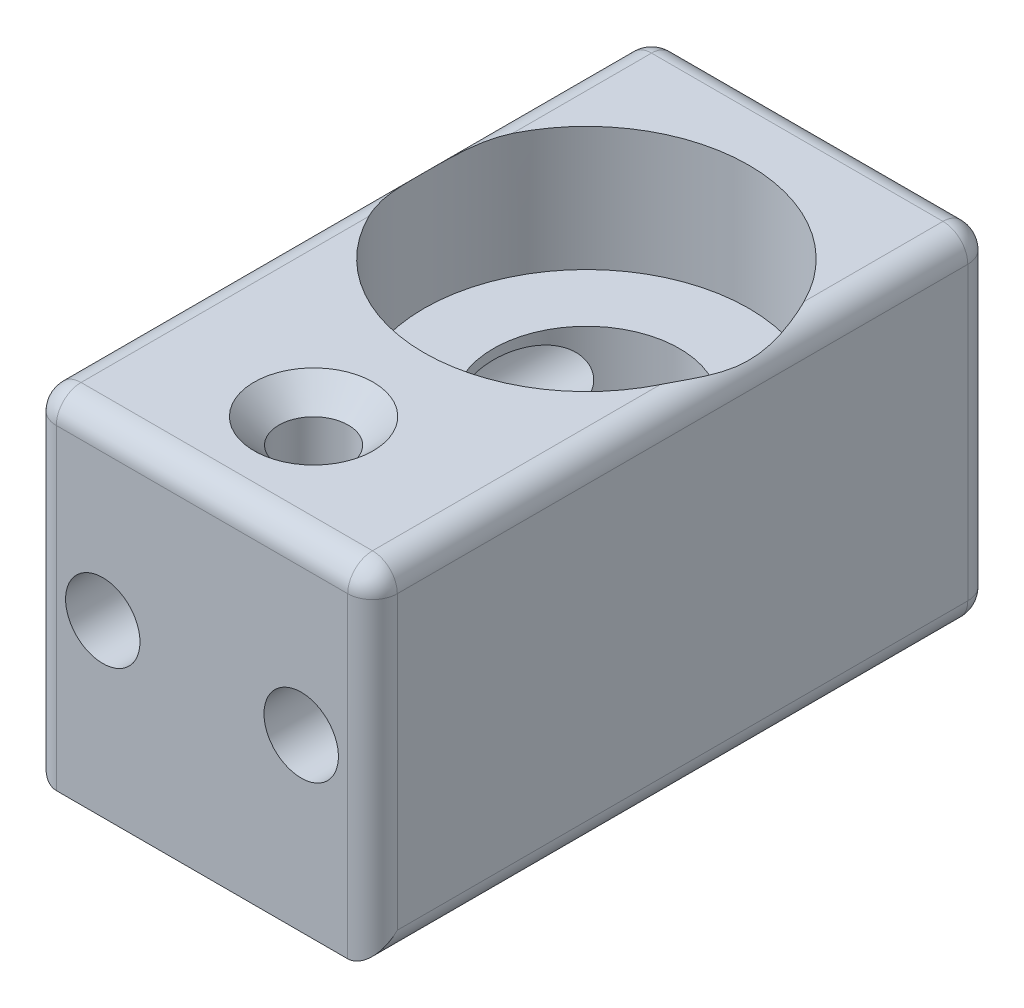
from build123d import *

# Parameters (mm, degrees)
SKETCH1_W           = 13.75
SKETCH1_H           = 13.75
BOSS_EXTRUDE1_DEPTH = 25
SKETCH3_R           = 3.75
CUT_EXTRUDE2_DEPTH  = 30.348392205
SKETCH4_R           = 6.55
CUT_EXTRUDE3_DEPTH  = 5
SKETCH8_R           = 1.4
CUT_EXTRUDE6_DEPTH  = 30.348392205
SKETCH9_R           = 1.5
CUT_EXTRUDE7_DEPTH  = 27.824079667
CHAMFER1_SIZE       = 1
FILLET2_R           = 1


with BuildPart() as part:
    # Sketch1 → Boss-Extrude1 (new body)
    with BuildSketch(Plane.XY):
        Rectangle(SKETCH1_W, SKETCH1_H)
    extrude(amount=BOSS_EXTRUDE1_DEPTH)

    # Sketch3 → Cut-Extrude2 (cut, through all)
    with BuildSketch(Plane(origin=(0, 6.875, 0), x_dir=(1, 0, 0), z_dir=(0, 1, 0))):
        with Locations(Location((0, -9.5, 0), (0, 0, 270))):
            Circle(SKETCH3_R)
    extrude(amount=-CUT_EXTRUDE2_DEPTH, mode=Mode.SUBTRACT)

    # Sketch4 → Cut-Extrude3 (cut)
    with BuildSketch(Plane(origin=(0, 6.875, 0), x_dir=(1, 0, 0), z_dir=(0, 1, 0))):
        with Locations(Location((0, -9.5, 0), (0, 0, 270))):
            Circle(SKETCH4_R)
    cut_extrude3 = extrude(amount=-CUT_EXTRUDE3_DEPTH, mode=Mode.SUBTRACT)

    # Mirror4: Cut-Extrude3 across plane
    add(cut_extrude3.mirror(Plane.ZX), mode=Mode.SUBTRACT)

    # Sketch8 → Cut-Extrude6 (cut, through all)
    with BuildSketch(Plane(origin=(0, 6.875, 0), x_dir=(1, 0, 0), z_dir=(0, 1, 0))):
        with Locations(Location((0, -20.5, 0), (0, 0, 270))):
            Circle(SKETCH8_R)
    extrude(amount=-CUT_EXTRUDE6_DEPTH, mode=Mode.SUBTRACT)

    # Sketch9 → Cut-Extrude7 (cut, through all)
    with BuildSketch(Plane(origin=(0, 0, 0), x_dir=(-1, 0, 0), z_dir=(0, 0, -1))):
        with Locations((-4, 0)):
            Circle(SKETCH9_R)
    cut_extrude7 = extrude(amount=-CUT_EXTRUDE7_DEPTH, mode=Mode.SUBTRACT)

    # Mirror5: Cut-Extrude7 across plane
    add(cut_extrude7.mirror(Plane(origin=(0, 0, 0), x_dir=(0, 0, 1), z_dir=(1, 0, 0))), mode=Mode.SUBTRACT)

    # Chamfer1
    chamfer1_edges = [part.edges().sort_by_distance(p)[0] for p in [
        (0, -6.875, 19.1),
        (0, 6.875, 19.1),
    ]]
    chamfer(chamfer1_edges, length=CHAMFER1_SIZE)

    # Fillet2
    # the kernel refuses this fillet: 1 mm, written as the material it takes off along each edge
    with BuildSketch(Plane(origin=(-5.875, 5.875, 24), x_dir=(-1, 0, 0), z_dir=(0, 1, 0))) as fillet2_piece_1_section:
        Polygon((0, 0), (FILLET2_R, 0), (FILLET2_R, FILLET2_R), (0, FILLET2_R), align=None)
    fillet2_piece_1 = extrude(amount=FILLET2_R, mode=Mode.PRIVATE)
    fillet2_piece_1 = fillet2_piece_1 - Plane(origin=(-5.875, 5.875, 24), x_dir=(0.7071067811865475, 0, -0.7071067811865475), z_dir=(0, 1, 0)) * Sphere(FILLET2_R, mode=Mode.PRIVATE)
    add(fillet2_piece_1, mode=Mode.SUBTRACT)
    with BuildSketch(Plane(origin=(5.875, 5.875, 24), x_dir=(0, 0, 1), z_dir=(0, 1, 0))) as fillet2_piece_2_section:
        Polygon((0, 0), (FILLET2_R, 0), (FILLET2_R, FILLET2_R), (0, FILLET2_R), align=None)
    fillet2_piece_2 = extrude(amount=FILLET2_R, mode=Mode.PRIVATE)
    fillet2_piece_2 = fillet2_piece_2 - Plane(origin=(5.875, 5.875, 24), x_dir=(-0.7071067811865475, 0, -0.7071067811865475), z_dir=(0, 1, 0)) * Sphere(FILLET2_R, mode=Mode.PRIVATE)
    add(fillet2_piece_2, mode=Mode.SUBTRACT)
    with BuildSketch(Plane(origin=(-5.875, -5.875, 1), x_dir=(-1, 0, 0), z_dir=(0, -1, 0))) as fillet2_piece_3_section:
        Polygon((0, 0), (FILLET2_R, 0), (FILLET2_R, FILLET2_R), (0, FILLET2_R), align=None)
    fillet2_piece_3 = extrude(amount=FILLET2_R, mode=Mode.PRIVATE)
    fillet2_piece_3 = fillet2_piece_3 - Plane(origin=(-5.875, -5.875, 1), x_dir=(0.7071067811865475, 0, 0.7071067811865475), z_dir=(0, -1, 0)) * Sphere(FILLET2_R, mode=Mode.PRIVATE)
    add(fillet2_piece_3, mode=Mode.SUBTRACT)
    with BuildSketch(Plane(origin=(5.875, -5.875, 1), x_dir=(0, 0, -1), z_dir=(0, -1, 0))) as fillet2_piece_4_section:
        Polygon((0, 0), (FILLET2_R, 0), (FILLET2_R, FILLET2_R), (0, FILLET2_R), align=None)
    fillet2_piece_4 = extrude(amount=FILLET2_R, mode=Mode.PRIVATE)
    fillet2_piece_4 = fillet2_piece_4 - Plane(origin=(5.875, -5.875, 1), x_dir=(-0.7071067811865475, 0, 0.7071067811865475), z_dir=(0, -1, 0)) * Sphere(FILLET2_R, mode=Mode.PRIVATE)
    add(fillet2_piece_4, mode=Mode.SUBTRACT)
    with BuildSketch(Plane(origin=(-5.875, 5.875, 1), x_dir=(-1, 0, 0), z_dir=(0, 1, 0))) as fillet2_piece_5_section:
        Polygon((0, 0), (FILLET2_R, 0), (FILLET2_R, -FILLET2_R), (0, -FILLET2_R), align=None)
    fillet2_piece_5 = extrude(amount=FILLET2_R, mode=Mode.PRIVATE)
    fillet2_piece_5 = fillet2_piece_5 - Plane(origin=(-5.875, 5.875, 1), x_dir=(0.7071067811865475, 0, 0.7071067811865475), z_dir=(0, 1, 0)) * Sphere(FILLET2_R, mode=Mode.PRIVATE)
    add(fillet2_piece_5, mode=Mode.SUBTRACT)
    with BuildSketch(Plane(origin=(5.875, 5.875, 1), x_dir=(0, 0, -1), z_dir=(0, 1, 0))) as fillet2_piece_6_section:
        Polygon((0, 0), (FILLET2_R, 0), (FILLET2_R, -FILLET2_R), (0, -FILLET2_R), align=None)
    fillet2_piece_6 = extrude(amount=FILLET2_R, mode=Mode.PRIVATE)
    fillet2_piece_6 = fillet2_piece_6 - Plane(origin=(5.875, 5.875, 1), x_dir=(-0.7071067811865475, 0, 0.7071067811865475), z_dir=(0, 1, 0)) * Sphere(FILLET2_R, mode=Mode.PRIVATE)
    add(fillet2_piece_6, mode=Mode.SUBTRACT)
    with BuildSketch(Plane(origin=(-6.875, 5.875, 25), x_dir=(0, 0, -1), z_dir=(0, -1, 0))) as fillet2_piece_7:
        with BuildLine():
            CenterArc((FILLET2_R, FILLET2_R), FILLET2_R, 180, 90)
            Line((0, FILLET2_R), (0, 0))
            Line((0, 0), (FILLET2_R, 0))
        make_face()
    extrude(amount=15.25, mode=Mode.SUBTRACT)
    with BuildSketch(Plane(origin=(6.875, -9.375, 25), x_dir=(-1, 0, 0), z_dir=(0, 1, 0))) as fillet2_piece_8:
        with BuildLine():
            CenterArc((FILLET2_R, -FILLET2_R), FILLET2_R, 90, 90)
            Line((0, -FILLET2_R), (0, 0))
            Line((0, 0), (FILLET2_R, 0))
        make_face()
    extrude(amount=15.25, mode=Mode.SUBTRACT)
    with BuildSketch(Plane(origin=(-5.875, -6.875, 0), x_dir=(0, 0, 1), z_dir=(1, 0, 0)), Plane(origin=(-6.875, 5.875, 0), x_dir=(0, 0, 1), z_dir=(0, -1, 0)), Plane(origin=(5.875, 6.875, 25), x_dir=(0, -1, 0), z_dir=(-1, 0, 0))) as fillet2_piece_9:
        with BuildLine():
            CenterArc((FILLET2_R, -FILLET2_R), FILLET2_R, 90, 90)
            Line((0, -FILLET2_R), (0, 0))
            Line((0, 0), (FILLET2_R, 0))
        make_face()
    extrude(amount=11.75, mode=Mode.SUBTRACT)
    with BuildSketch(Plane(origin=(5.875, 6.875, 0), x_dir=(0, -1, 0), z_dir=(-1, 0, 0)), Plane(origin=(6.875, -5.875, 0), x_dir=(-1, 0, 0), z_dir=(0, 1, 0))) as fillet2_piece_10:
        with BuildLine():
            CenterArc((FILLET2_R, FILLET2_R), FILLET2_R, 180, 90)
            Line((0, FILLET2_R), (0, 0))
            Line((0, 0), (FILLET2_R, 0))
        make_face()
    extrude(amount=11.75, mode=Mode.SUBTRACT)
    with BuildSketch(Plane(origin=(6.875, -6.875, 1), x_dir=(-1, 0, 0), z_dir=(0, 0, 1))) as fillet2_piece_11:
        with BuildLine():
            CenterArc((FILLET2_R, -FILLET2_R), FILLET2_R, 90, 90)
            Line((0, -FILLET2_R), (0, 0))
            Line((0, 0), (FILLET2_R, 0))
        make_face()
    extrude(amount=26.5, mode=Mode.SUBTRACT)
    with BuildSketch(Plane(origin=(-6.875, -6.875, 1), x_dir=(1, 0, 0), z_dir=(0, 0, 1))) as fillet2_piece_12:
        with BuildLine():
            CenterArc((FILLET2_R, FILLET2_R), FILLET2_R, 180, 90)
            Line((0, FILLET2_R), (0, 0))
            Line((0, 0), (FILLET2_R, 0))
        make_face()
    extrude(amount=26.5, mode=Mode.SUBTRACT)
    with BuildSketch(Plane(origin=(-6.875, 6.875, 1), x_dir=(0, -1, 0), z_dir=(0, 0, 1))) as fillet2_piece_13:
        with BuildLine():
            CenterArc((FILLET2_R, FILLET2_R), FILLET2_R, 180, 90)
            Line((0, FILLET2_R), (0, 0))
            Line((0, 0), (FILLET2_R, 0))
        make_face()
    extrude(amount=23, mode=Mode.SUBTRACT)
    with BuildSketch(Plane(origin=(6.875, 6.875, 1), x_dir=(0, -1, 0), z_dir=(0, 0, 1))) as fillet2_piece_14:
        with BuildLine():
            CenterArc((FILLET2_R, -FILLET2_R), FILLET2_R, 90, 90)
            Line((0, -FILLET2_R), (0, 0))
            Line((0, 0), (FILLET2_R, 0))
        make_face()
    extrude(amount=23, mode=Mode.SUBTRACT)


solid = part.part
